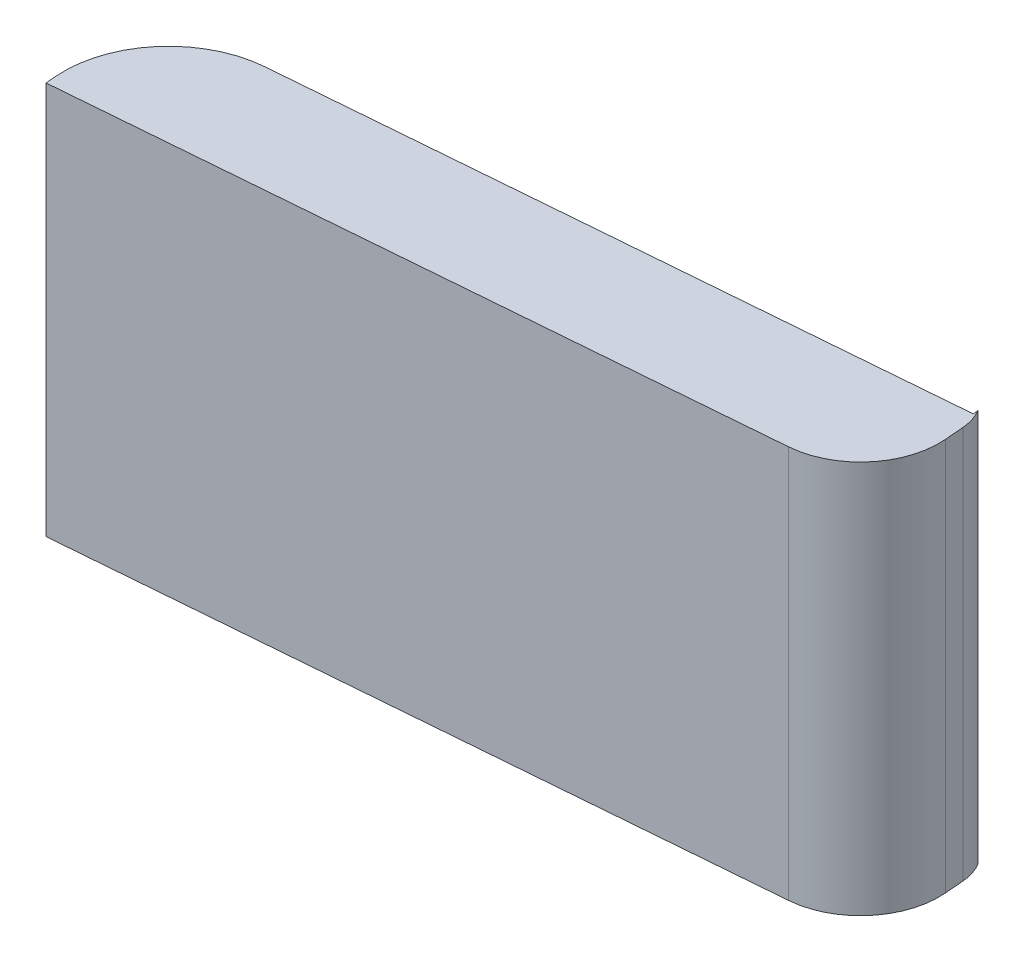
from build123d import *

# Parameters (mm, degrees)
EXTRUDE_THIN1_DEPTH   = 150
SKETCH5_W             = 290.970262873
SKETCH5_H             = 4
EXTRUDE_THIN2_DEPTH   = 42
EXTRUDE_THIN2_2_DEPTH = 42
FILLET6_R             = 40
EXTRUDE_THIN7_DEPTH   = 146
FILLET14_R            = 40
SKETCH25_W            = 46
SKETCH25_H            = 150
BOSS_EXTRUDE1_DEPTH   = 2
FILLET22_R            = 30
FILLET28_R            = 30
FILLET32_R            = 20
SKETCH29_W            = 6.511049677
SKETCH29_H            = 4.056851241
BOSS_EXTRUDE2_DEPTH   = 42
EXTRUDE_THIN8_DEPTH   = 142


with BuildPart() as part:
    # Sketch2 → Extrude-Thin1 (new body)
    with BuildSketch(Plane(origin=(0, 0, 0), x_dir=(1, 0, 0), z_dir=(0, 1, 0))):
        Polygon((-30.965120595, -2.565260163), (-320.965120595, -26.307498403), (-320.801927023, -28.300829248), (-30.801927023, -4.558591008), align=None)
    extrude(amount=EXTRUDE_THIN1_DEPTH)



with BuildPart() as body_2:
    # Sketch5 → Extrude-Thin2 (new body)
    with BuildSketch(Plane(origin=(0.002452129, 0, 0.029951579), x_dir=(-0.9966654225627806, 0, 0.08159678589107741), z_dir=(-0.08159678589107741, 0, -0.9966654225627806))):
        with Locations((176.556313424, 2)):
            Rectangle(SKETCH5_W, SKETCH5_H)
    extrude(amount=EXTRUDE_THIN2_DEPTH)

    # Fillet14
    fillet14_edges = [body_2.edges().sort_by_distance(p)[0] for p in [
        (-324.392185602, 2, -15.552449344),
    ]]
    fillet(fillet14_edges, radius=FILLET14_R)


with BuildPart() as body_3:
    # Sketch5 → Extrude-Thin2 2 (new body)
    with BuildSketch(Plane(origin=(0.002452129, 0, 0.029951579), x_dir=(-0.9966654225627806, 0, 0.08159678589107741), z_dir=(-0.08159678589107741, 0, -0.9966654225627806))):
        with Locations((176.556313424, 148)):
            Rectangle(SKETCH5_W, SKETCH5_H)
    extrude(amount=EXTRUDE_THIN2_2_DEPTH)

    # Fillet6
    fillet6_edges = [body_3.edges().sort_by_distance(p)[0] for p in [
        (-324.392185602, 148, -15.552449344),
    ]]
    fillet(fillet6_edges, radius=FILLET6_R)


with BuildPart() as part_1:
    add(part.part)

    add(body_3.part)  # Extrude-Thin7 merges body 3
    # Sketch11 → Extrude-Thin7 (add)
    with BuildSketch(Plane.XZ.offset(-146)):
        Polygon((-278.003111059, -19.350312998), (-281.936630301, -19.587972456), (-284.5255687, -18.81632078), (-290.805852057, -18.238730686), (-291.798277728, -17.537013607), (-298.288108084, -15.145025876), (-304.254167802, -11.68113065), (-309.528907685, -7.251025667), (-313.810104121, -2.200536359), (-317.466443209, 4.043933459), (-318.345283528, 5.696861164), (-319.86163909, 10.560086826), (-321.089242867, 17.33995769), (-321.128314167, 24.314167558), (-320.965120595, 26.307498403), (-318.97178975, 26.144304832), (-319.127856228, 24.238027995), (-319.090248803, 17.52511906), (-317.915603526, 11.037730019), (-316.491598121, 6.470687959), (-315.719800302, 5.019086377), (-312.17205348, -1.039924404), (-308.112866331, -5.828511332), (-303.100359764, -10.038373964), (-297.433799934, -13.328379507), (-290.85904721, -15.751667479), (-290.088883869, -16.296228937), (-284.144627091, -16.842915072), (-281.704255181, -17.570285439), (-278.123729185, -17.353953494), align=None)
    extrude(amount=EXTRUDE_THIN7_DEPTH)


    add(body_2.part)  # Boss-Extrude1 merges body 2
    # Sketch25 → Boss-Extrude1 (add)
    with BuildSketch(Plane(origin=(-30.967572724, 0, 2.535308584), x_dir=(-0.08159678589107766, 0, -0.9966654225627805), z_dir=(0.9966654225627803, 0, -0.08159678589107765))):
        with Locations((20.969948211, 75)):
            Rectangle(SKETCH25_W, SKETCH25_H)
    extrude(amount=BOSS_EXTRUDE1_DEPTH)

    # Fillet22
    fillet22_edges = [part_1.edges().sort_by_distance(p)[0] for p in [
        (-30.965120595, 75, 2.565260163),
    ]]
    fillet(fillet22_edges, radius=FILLET22_R)

    # Fillet28
    fillet28_edges = [part_1.edges().sort_by_distance(p)[0] for p in [
        (-28.808596178, 75, 4.395397436),
    ]]
    fillet(fillet28_edges, radius=FILLET28_R)

    # Fillet32
    # the kernel refuses this fillet: 20 mm, written as the material it takes off along each edge
    with BuildSketch(Plane(origin=(-32.562048329, -21.794494718, -41.451212002), x_dir=(0.08159678589107701, 0, 0.9966654225627805), z_dir=(0, 1, 0))) as fillet32_piece_1:
        with BuildLine():
            CenterArc((8.717797887, -20), FILLET32_R, 90, 25.841932763)
            Line((0, -2), (0, 0))
            Line((0, 0), (8.717797887, 0))
        make_face()
    extrude(amount=193.588989435, mode=Mode.SUBTRACT)

    # Sketch29 → Boss-Extrude2 (add)
    with BuildSketch(Plane(origin=(0.002452129, 0, 0.029951579), x_dir=(-0.9966654225627805, 0, 0.0815967858910774), z_dir=(-0.0815967858910774, 0, -0.9966654225627805))):
        with Locations((150.499315868, 143.971574379)):
            Rectangle(SKETCH29_W, SKETCH29_H)
    extrude(amount=BOSS_EXTRUDE2_DEPTH)

    # Sketch35 → Extrude-Thin8 (add)
    with BuildSketch(Plane.XZ.offset(-146)):
        Polygon((-34.392185602, -39.294687585), (-38.941474001, -38.922238312), (-38.77828043, -36.928907467), (-34.228992031, -37.30135674), align=None)
    extrude(amount=EXTRUDE_THIN8_DEPTH)


solid = part_1.part
